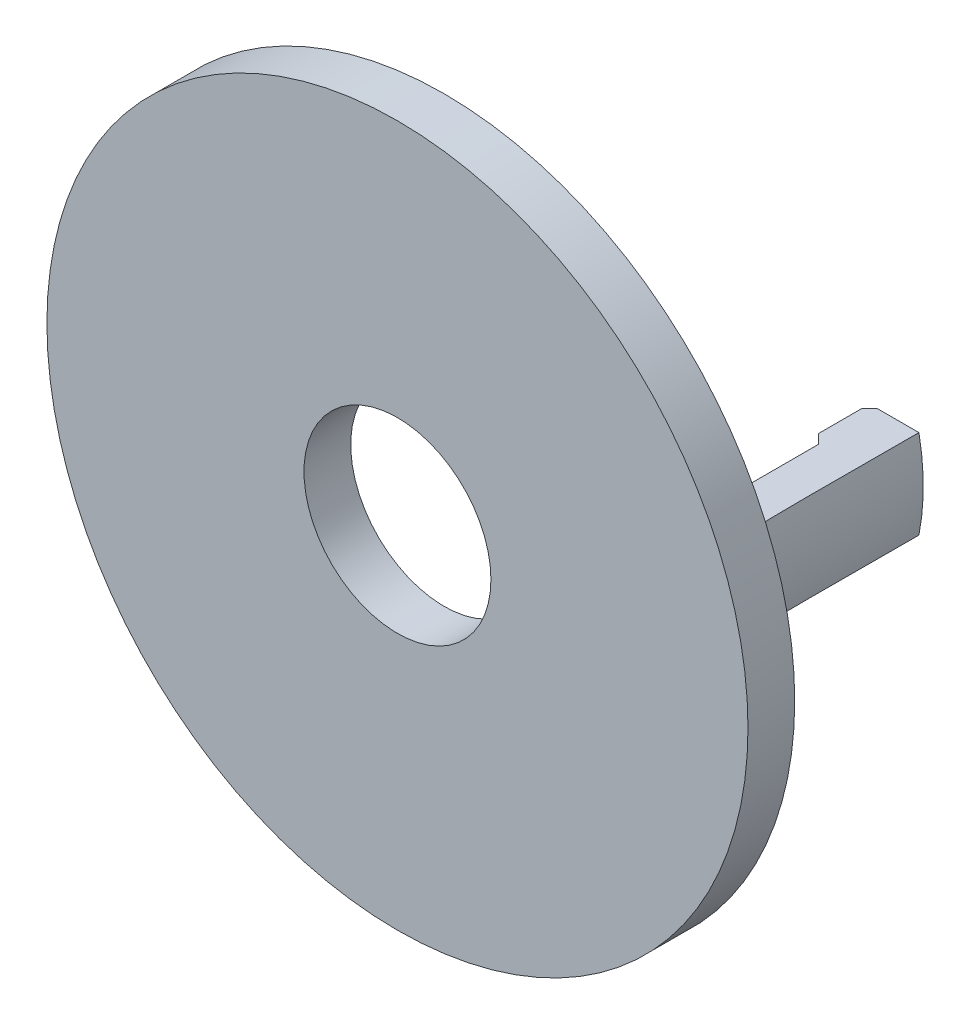
from build123d import *

# Parameters (mm, degrees)
GUARD_BASE_SKETCH_R      = 37.5
GUARD_DEPTH              = 5
INNER_AXLE_BASE_SKETCH_R = 10
INNER_AXLE_HOLE_DEPTH    = 54.268189382
COUPLING_TOOTH_DEPTH     = 4.75


with BuildPart() as part:
    # Guard base sketch → Guard (new body)
    with BuildSketch(Plane.XY):
        Circle(GUARD_BASE_SKETCH_R)
    extrude(amount=GUARD_DEPTH)

    # Inner axle base sketch → Inner axle hole (cut, through all)
    with BuildSketch(Plane.XY.offset(5)):
        Circle(INNER_AXLE_BASE_SKETCH_R)
    extrude(amount=-INNER_AXLE_HOLE_DEPTH, mode=Mode.SUBTRACT)

    # Coupling tooth base sketch → Coupling tooth (add, symmetric)
    with BuildSketch(Plane(origin=(0, 0, 0), x_dir=(1, 0, 0), z_dir=(0, 1, 0))):
        with BuildLine():
            Line((16.853553391, 0), (26, 0))
            add(Edge.make_bspline(
                [(24.5, 26.75), (24.5, 22.72818992), (24.490050178, 20.542467854), (24.51194908, 14.942357728), (24.274871471, 4.983935506), (26, 0)],
                knots=[0, 0, 0, 0, 0.44660472, 0.54660472, 1, 1, 1, 1], degree=3))
            Line((24.5, 26.75), (19.603553391, 26.75))
            Line((19.603553391, 26.75), (18.75, 25.896446609))
            Line((18.75, 25.896446609), (18.75, 21.310660172))
            Line((18.75, 21.310660172), (19.75, 20.310660172))
            Line((19.75, 20.310660172), (19.75, 2.896446609))
            Line((19.75, 2.896446609), (16.853553391, 0))
        make_face()
    coupling_tooth = extrude(amount=COUPLING_TOOTH_DEPTH, both=True)

    # Sketch6<4> → Circularity cut (revolve, cut)
    with BuildSketch(Plane(origin=(0, 0, 0), x_dir=(1, 0, 0), z_dir=(0, 1, 0))):
        with BuildLine():
            add(Edge.make_bspline(
                [(24.5, 26.75), (24.5, 22.72818992), (24.490050178, 20.542467854), (24.51194908, 14.942357728), (24.274871471, 4.983935506), (26, 0)],
                knots=[0, 0, 0, 0, 0.44660472, 0.54660472, 1, 1, 1, 1], degree=3))
            Line((26, 0), (37.5, 0))
            Line((37.5, 0), (37.5, 26.75))
            Line((37.5, 26.75), (24.5, 26.75))
        make_face()
    circularity_cut = revolve(axis=Axis((0, 0, 0), (0, 0, -1)), mode=Mode.SUBTRACT)

    # Coupling teeth: Coupling tooth, Circularity cut across plane
    add(coupling_tooth.mirror(Plane(origin=(0, 0, 0), x_dir=(0, 0, 1), z_dir=(1, 0, 0))))
    add(circularity_cut.mirror(Plane(origin=(0, 0, 0), x_dir=(0, 0, 1), z_dir=(1, 0, 0))), mode=Mode.SUBTRACT)


solid = part.part
